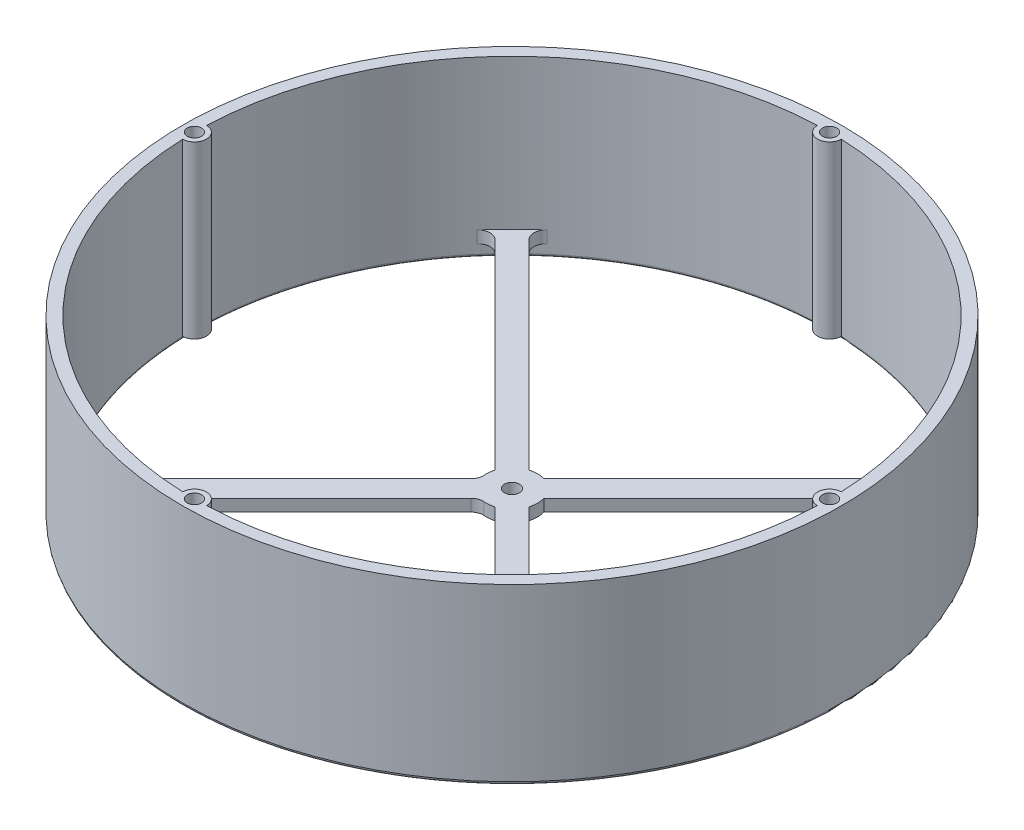
from build123d import *

# Parameters (mm, degrees)
SKETCH1_R           = 69.85
BOSS_EXTRUDE1_DEPTH = 34.29
SKETCH5_R           = 67.30999999999999
CUT_EXTRUDE1_DEPTH  = 105.56504721942221
SKETCH6_R           = 2.539999999999996
SKETCH6_R_2         = 2.5399999999999983
SKETCH6_R_3         = 2.5400000000000005
SKETCH6_R_4         = 2.53999999999999
BOSS_EXTRUDE3_DEPTH = 36.195
SKETCH12_R          = 1.523999999999992
SKETCH12_R_2        = 1.5239999999999905
SKETCH12_R_3        = 1.523999999999989
SKETCH12_R_4        = 1.5239999999999874
CUT_EXTRUDE3_DEPTH  = 11.43
BOSS_EXTRUDE4_START = -2.54
SKETCH13_R          = 1.599999999999998
BOSS_EXTRUDE4_DEPTH = 2.54
FILLET1_R           = 2.54
CIRPATTERN2_DEPTH   = 2.54
SKETCH14_R          = 69.85
SKETCH14_R_2        = 67.30999999999997
BOSS_EXTRUDE5_DEPTH = 2.54


with BuildPart() as part:
    # Sketch1 → Boss-Extrude1 (new body)
    with BuildSketch(Plane(origin=(0, 0, 0), x_dir=(1, 0, 0), z_dir=(0, 1, 0))):
        with Locations(Location((0, 0, 0), (0, 0, 270))):
            Circle(SKETCH1_R)
    extrude(amount=BOSS_EXTRUDE1_DEPTH)

    # Sketch5 → Cut-Extrude1 (cut, through all)
    with BuildSketch(Plane(origin=(0, 34.29, 0), x_dir=(1, 0, 0), z_dir=(0, 1, 0))):
        with Locations(Location((0, 0, 0), (0, 0, 270))):
            Circle(SKETCH5_R)
    extrude(amount=-CUT_EXTRUDE1_DEPTH, mode=Mode.SUBTRACT)

    # Sketch6 → Boss-Extrude3 (add)
    with BuildSketch(Plane(origin=(0, 34.29, 0), x_dir=(1, 0, 0), z_dir=(0, 1, 0))):
        with Locations(Location((67.30999999999999, 0, 0), (0, 0, 270))):
            Circle(SKETCH6_R)
        with Locations(Location((-2.3501e-13, 67.30999999999999, 0), (0, 0, 270))):
            Circle(SKETCH6_R_2)
        with Locations(Location((-67.30999999999999, -4.7002e-13, 0), (0, 0, 270))):
            Circle(SKETCH6_R_3)
        with Locations(Location((7.0503e-13, -67.30999999999999, 0), (0, 0, 270))):
            Circle(SKETCH6_R_4)
    extrude(amount=-BOSS_EXTRUDE3_DEPTH)

    # Sketch12 → Cut-Extrude3 (cut)
    with BuildSketch(Plane(origin=(0, 34.29, 0), x_dir=(1, 0, 0), z_dir=(0, 1, 0))):
        with Locations(Location((-67.30999999999999, 0, 0), (0, 0, 270))):
            Circle(SKETCH12_R)
        with Locations(Location((2.3501e-13, 67.30999999999999, 0), (0, 0, 270))):
            Circle(SKETCH12_R_2)
        with Locations(Location((67.30999999999999, -4.7002e-13, 0), (0, 0, 270))):
            Circle(SKETCH12_R_3)
        with Locations(Location((-7.0503e-13, -67.30999999999999, 0), (0, 0, 270))):
            Circle(SKETCH12_R_4)
    extrude(amount=-CUT_EXTRUDE3_DEPTH, mode=Mode.SUBTRACT)

    # Sketch13 → Boss-Extrude4 (add)
    with BuildSketch(Plane.XZ.offset(BOSS_EXTRUDE4_START)):
        with BuildLine():
            Line((-49.35750883434136, 45.76540638591458), (-5.173661326046175, 1.5815588776185732))
            ThreePointArc((-5.173661326046175, 1.5815588776185732), (3.825447686219193, -3.825447686219249), (-1.5815588776184986, 5.173661326046197))
            Line((-1.5815588776184986, 5.173661326046197), (-45.76540638591367, 49.35750883434221))
            ThreePointArc((-45.76540638591367, 49.35750883434221), (-47.59535744166605, 47.59535744166695), (-49.35750883434136, 45.76540638591458))
        make_face()
        with Locations(Location((0, 0, 0), (0, 0, 270))):
            Circle(SKETCH13_R, mode=Mode.SUBTRACT)
    extrude(amount=BOSS_EXTRUDE4_DEPTH)

    # Fillet1
    fillet1_edges = [part.edges().sort_by_distance(p)[0] for p in [
        (-49.35750883434137, 1.27, 45.76540638591459),
        (-45.76540638591368, 1.27, 49.35750883434221),
        (-1.5815588776184981, 1.27, 5.173661326046197),
        (-5.173661326046176, 1.27, 1.5815588776185734),
    ]]
    fillet(fillet1_edges, radius=FILLET1_R)

    # CirPattern2: read off the stored shape, not the designer's step
    # CirPattern2 outline → CirPattern2 (add)
    with BuildSketch(Plane(origin=(0, 0, 0), x_dir=(1, 0, 0), z_dir=(0, 1, 0))):
        with BuildLine():
            ThreePointArc((1.581558878, 5.173661326), (3.825447686, 3.825447686), (5.173661326, 1.581558878))
            Line((5.173661326, 1.581558878), (47.454273375, 43.862170927))
            ThreePointArc((47.454273375, 43.862170927), (49.350009241, 44.604162841), (51.181709878, 43.715771456))
            ThreePointArc((51.181709878, 43.715771456), (47.595357442, 47.595357442), (43.715771456, 51.181709878))
            ThreePointArc((43.715771456, 51.181709878), (44.604162841, 49.350009241), (43.862170927, 47.454273375))
            Line((43.862170927, 47.454273375), (1.581558878, 5.173661326))
        make_face()
        with BuildLine():
            ThreePointArc((-5.173661326, 1.581558878), (-3.825447686, 3.825447686), (-1.581558878, 5.173661326))
            Line((-1.581558878, 5.173661326), (-43.862170927, 47.454273375))
            ThreePointArc((-43.862170927, 47.454273375), (-44.604162841, 49.350009241), (-43.715771456, 51.181709878))
            ThreePointArc((-43.715771456, 51.181709878), (-47.595357442, 47.595357442), (-51.181709878, 43.715771456))
            ThreePointArc((-51.181709878, 43.715771456), (-49.350009241, 44.604162841), (-47.454273375, 43.862170927))
            Line((-47.454273375, 43.862170927), (-5.173661326, 1.581558878))
        make_face()
        with BuildLine():
            Line((47.454273375, -43.862170927), (5.173661326, -1.581558878))
            ThreePointArc((5.173661326, -1.581558878), (3.825447686, -3.825447686), (1.581558878, -5.173661326))
            Line((1.581558878, -5.173661326), (43.862170927, -47.454273375))
            ThreePointArc((43.862170927, -47.454273375), (44.604162841, -49.350009241), (43.715771456, -51.181709878))
            ThreePointArc((43.715771456, -51.181709878), (47.595357442, -47.595357442), (51.181709878, -43.715771456))
            ThreePointArc((51.181709878, -43.715771456), (49.350009241, -44.604162841), (47.454273375, -43.862170927))
        make_face()
    extrude(amount=CIRPATTERN2_DEPTH)

    # Sketch14 → Boss-Extrude5 (add)
    with BuildSketch(Plane.XZ):
        with Locations(Location((0, 0, 0), (0, 0, 270))):
            Circle(SKETCH14_R)
        with Locations(Location((0, 0, 0), (0, 0, 92.162233192))):
            Circle(SKETCH14_R_2, mode=Mode.SUBTRACT)
    extrude(amount=BOSS_EXTRUDE5_DEPTH)

    # Fillet2: read off the stored shape, not the designer's step
    # Fillet2 outline → Fillet2 (revolve, cut)
    with BuildSketch(Plane.XY):
        with BuildLine():
            Line((69.85, -2.54), (69.85, -1.905))
            ThreePointArc((69.85, -1.905), (69.664012806, -2.354012806), (69.215, -2.54))
            Line((69.215, -2.54), (69.85, -2.54))
        make_face()
        with BuildLine():
            Line((67.31, -2.54), (67.945, -2.54))
            ThreePointArc((67.945, -2.54), (67.495987194, -2.354012806), (67.31, -1.905))
            Line((67.31, -1.905), (67.31, -2.54))
        make_face()
    revolve(axis=Axis((0, 0, 0), (0, 1, 0)), mode=Mode.SUBTRACT)


solid = part.part
